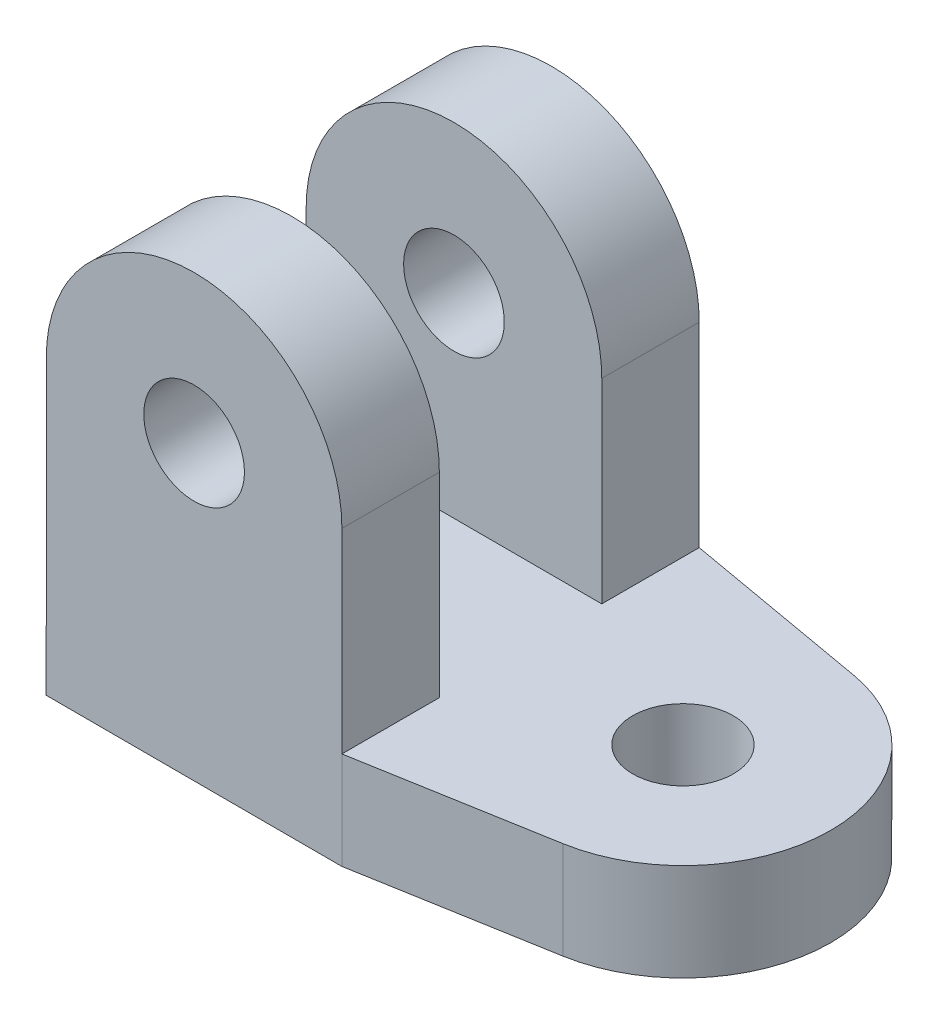
from build123d import *

# Parameters (mm, degrees)
SKETCH1_R           = 1.55
BOSS_EXTRUDE1_DEPTH = 3
SKETCH2_R           = 1.55
BOSS_EXTRUDE2_DEPTH = 3
SKETCH3_R           = 1.55
BOSS_EXTRUDE3_DEPTH = 3


with BuildPart() as part:
    # Sketch1 → Boss-Extrude1 (new body)
    with BuildSketch(Plane.XY):
        with BuildLine():
            Line((80.45, -5), (80.45, -11))
            Line((80.45, -11), (89.55, -11.011788251))
            Line((89.55, -11.011788251), (89.55, -5))
            ThreePointArc((89.55, -5), (85, -0.45), (80.45, -5))
        make_face()
        with Locations((85, -5)):
            Circle(SKETCH1_R, mode=Mode.SUBTRACT)
    extrude(amount=BOSS_EXTRUDE1_DEPTH)



with BuildPart() as body_2:
    # Sketch2 → Boss-Extrude2 (new body)
    with BuildSketch(Plane(origin=(0, 0, -5), x_dir=(-1, 0, 0), z_dir=(0, 0, -1))):
        with BuildLine():
            Line((-89.55, -11.011788251), (-80.45, -11))
            Line((-80.45, -11), (-80.45, -5))
            ThreePointArc((-80.45, -5), (-85, -0.45), (-89.55, -5))
            Line((-89.55, -5), (-89.55, -11.011788251))
        make_face()
        with Locations((-85, -5)):
            Circle(SKETCH2_R, mode=Mode.SUBTRACT)
    extrude(amount=BOSS_EXTRUDE2_DEPTH)


with BuildPart() as part_1:
    add(part.part)

    add(body_2.part)  # Boss-Extrude3 merges body 2
    # Sketch3 → Boss-Extrude3 (add)
    with BuildSketch(Plane(origin=(-0.014114508, -10.895765801, 0), x_dir=(0.999999160954613, -0.0012954111587492624, 0), z_dir=(-0.0012954111587492624, -0.999999160954613, 0))):
        with BuildLine():
            Line((95.352918097, 1.981116763), (89.564189657, 3))
            Line((89.564189657, 3), (80.464182022, 3))
            Line((80.464182022, 3), (80.464182022, -8))
            Line((80.464182022, -8), (89.564189657, -8))
            Line((89.564189657, -8), (95.352918097, -6.981116764))
            ThreePointArc((95.352918097, -6.981116764), (99.114189657, -2.5), (95.352918097, 1.981116763))
        make_face()
        with Locations((94.564189657, -2.5)):
            Circle(SKETCH3_R, mode=Mode.SUBTRACT)
    extrude(amount=BOSS_EXTRUDE3_DEPTH)


solid = part_1.part
